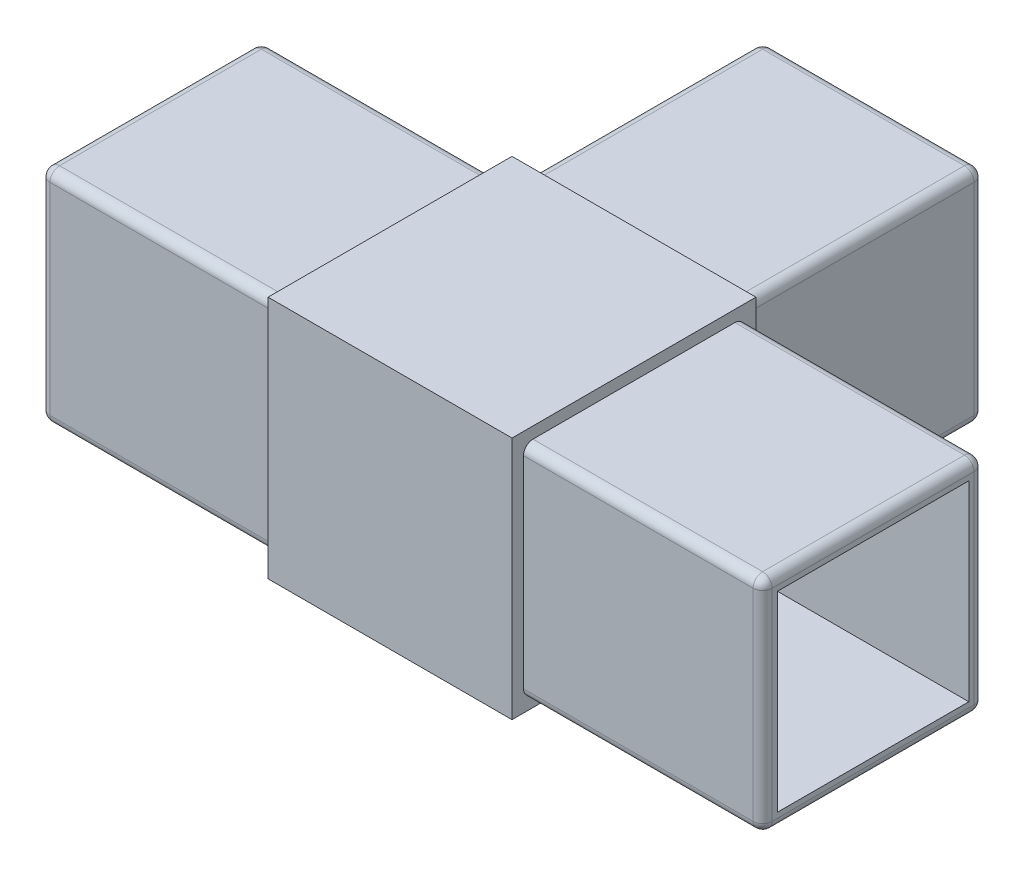
from build123d import *

# Parameters (mm, degrees)
BOSS_EXTRUDE2_DEPTH = 25.5
SKETCH2_W           = 23.1
SKETCH2_H           = 1.2
CUT_EXTRUDE1_DEPTH  = 25
SKETCH3_W           = 23.1
SKETCH3_H           = 1.2
CUT_EXTRUDE2_DEPTH  = 25
SKETCH4_W           = 23.1
SKETCH4_H           = 1.2
CUT_EXTRUDE3_DEPTH  = 25
SKETCH5_W           = 20
SKETCH5_H           = 20
CUT_EXTRUDE4_DEPTH  = 89.17915003
SKETCH8_W           = 20
SKETCH8_H           = 20
CUT_EXTRUDE5_DEPTH  = 30
FILLET1_R           = 1


with BuildPart() as part:
    # Sketch1 → Boss-Extrude2 (new body)
    with BuildSketch(Plane(origin=(0, 0, 0), x_dir=(1, 0, 0), z_dir=(0, 1, 0))):
        Polygon((-11.55, 37.75), (-11.55, 12.75), (-12.75, 12.75), (-12.75, 11.55), (-37.75, 11.55), (-37.75, -11.55), (-12.75, -11.55), (-12.75, -12.75), (12.75, -12.75), (12.75, -11.55), (37.75, -11.55), (37.75, 11.55), (12.75, 11.55), (12.75, 12.75), (11.55, 12.75), (11.55, 37.75), align=None)
    extrude(amount=BOSS_EXTRUDE2_DEPTH)

    # Sketch2 → Cut-Extrude1 (cut)
    with BuildSketch(Plane(origin=(37.75, 0, 0), x_dir=(0, 0, -1), z_dir=(1, 0, 0))):
        with Locations((0, 24.9)):
            Rectangle(SKETCH2_W, SKETCH2_H)
        with Locations((0, 0.6)):
            Rectangle(SKETCH2_W, SKETCH2_H)
    extrude(amount=-CUT_EXTRUDE1_DEPTH, mode=Mode.SUBTRACT)

    # Sketch3 → Cut-Extrude2 (cut)
    with BuildSketch(Plane.ZY.offset(37.75)):
        with Locations((0, 24.9)):
            Rectangle(SKETCH3_W, SKETCH3_H)
        with Locations((0, 0.6)):
            Rectangle(SKETCH3_W, SKETCH3_H)
    extrude(amount=-CUT_EXTRUDE2_DEPTH, mode=Mode.SUBTRACT)

    # Sketch4 → Cut-Extrude3 (cut)
    with BuildSketch(Plane(origin=(0, 0, -37.75), x_dir=(-1, 0, 0), z_dir=(0, 0, -1))):
        with Locations((0, 24.9)):
            Rectangle(SKETCH4_W, SKETCH4_H)
        with Locations((0, 0.6)):
            Rectangle(SKETCH4_W, SKETCH4_H)
    extrude(amount=-CUT_EXTRUDE3_DEPTH, mode=Mode.SUBTRACT)

    # Sketch5 → Cut-Extrude4 (cut, through all)
    with BuildSketch(Plane(origin=(37.75, 0, 0), x_dir=(0, 0, -1), z_dir=(1, 0, 0))):
        with Locations((0, 12.75)):
            Rectangle(SKETCH5_W, SKETCH5_H)
    extrude(amount=-CUT_EXTRUDE4_DEPTH, mode=Mode.SUBTRACT)

    # Sketch8 → Cut-Extrude5 (cut)
    with BuildSketch(Plane(origin=(0, 0, -37.75), x_dir=(-1, 0, 0), z_dir=(0, 0, -1))):
        with Locations((0, 12.75)):
            Rectangle(SKETCH8_W, SKETCH8_H)
    extrude(amount=-CUT_EXTRUDE5_DEPTH, mode=Mode.SUBTRACT)

    # Fillet1
    fillet1_edges = [part.edges().sort_by_distance(p)[0] for p in [
        (37.75, 1.2, 0),
        (37.75, 12.75, 11.55),
        (37.75, 24.3, 0),
        (37.75, 12.75, -11.55),
        (25.25, 1.2, 11.55),
        (25.25, 1.2, -11.55),
        (25.25, 24.3, 11.55),
        (25.25, 24.3, -11.55),
        (0, 1.2, -37.75),
        (11.55, 12.75, -37.75),
        (0, 24.3, -37.75),
        (-11.55, 12.75, -37.75),
        (11.55, 1.2, -25.25),
        (-11.55, 1.2, -25.25),
        (11.55, 24.3, -25.25),
        (-11.55, 24.3, -25.25),
        (-37.75, 1.2, 0),
        (-37.75, 24.3, 0),
        (-37.75, 12.75, 11.55),
        (-37.75, 12.75, -11.55),
        (-25.25, 1.2, -11.55),
        (-25.25, 1.2, 11.55),
        (-25.25, 24.3, 11.55),
        (-25.25, 24.3, -11.55),
    ]]
    fillet(fillet1_edges, radius=FILLET1_R)


solid = part.part
